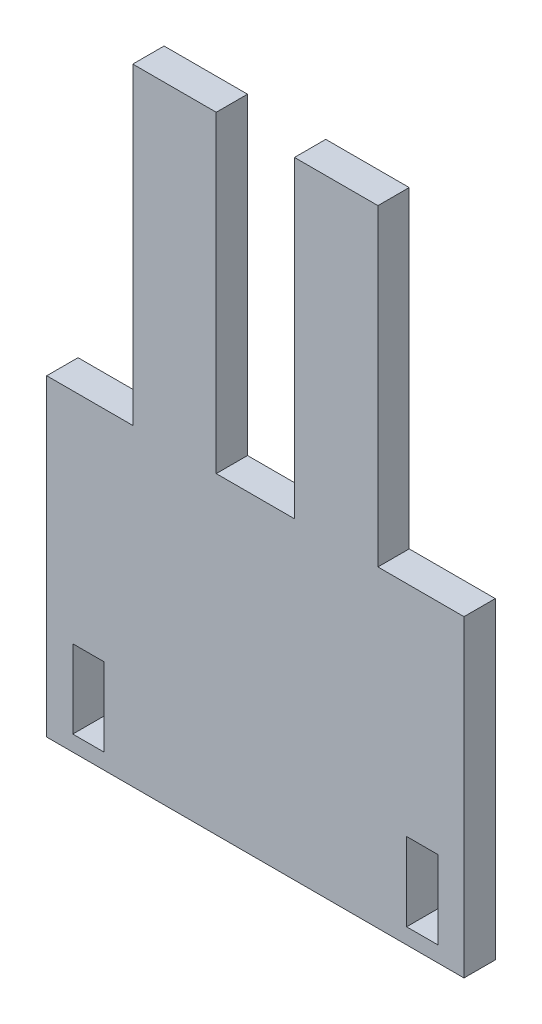
from build123d import *

# Parameters (mm, degrees)
ESQUISSE1_W        = 6
ESQUISSE1_H        = 15
BOSS_EXTRU_1_DEPTH = 6


with BuildPart() as part:
    # Esquisse1 → Boss.-Extru.1 (new body)
    with BuildSketch(Plane.XY):
        Polygon((23.067583758, -72.618715084), (23.067583758, -12.618715084), (6.567583758, -12.618715084), (6.567583758, 47.381284916), (-9.432416242, 47.381284916), (-9.432416242, -12.618715084), (-24.432416242, -12.618715084), (-24.432416242, 47.381284916), (-40.432416242, 47.381284916), (-40.432416242, -12.618715084), (-56.932416242, -12.618715084), (-56.932416242, -72.618715084), align=None)
        with Locations((15.067583758, -62.118715084)):
            Rectangle(ESQUISSE1_W, ESQUISSE1_H, mode=Mode.SUBTRACT)
        with Locations((-48.932416242, -62.118715084)):
            Rectangle(ESQUISSE1_W, ESQUISSE1_H, mode=Mode.SUBTRACT)
    extrude(amount=BOSS_EXTRU_1_DEPTH)


solid = part.part
